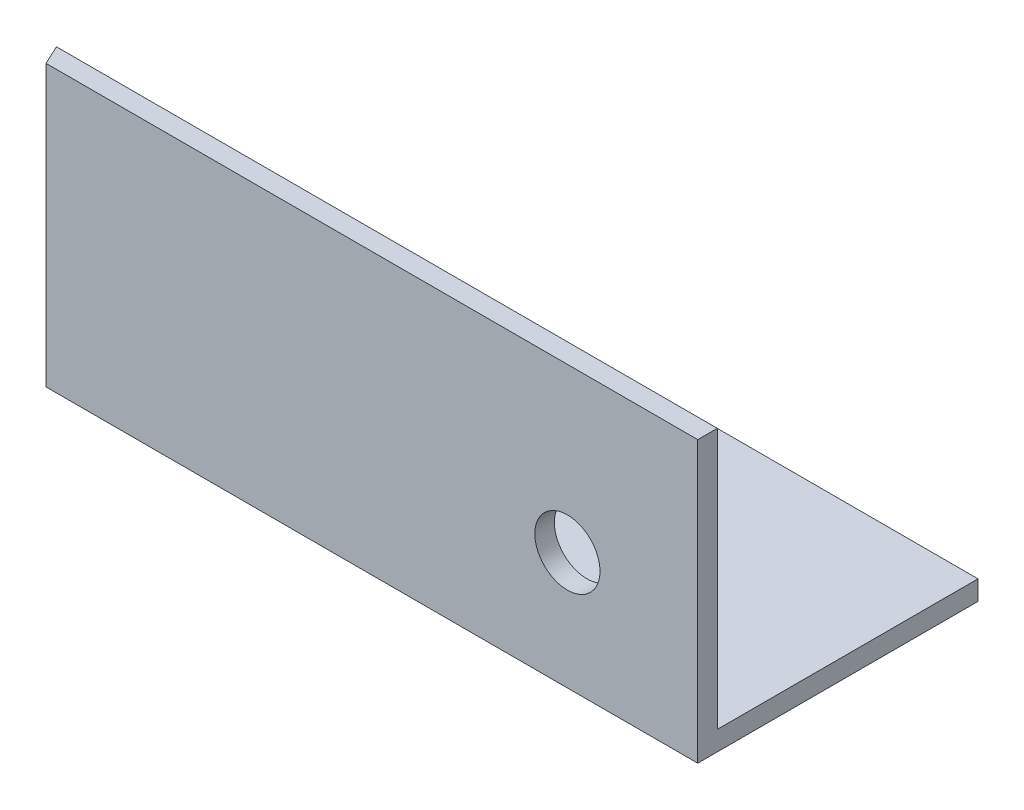
from build123d import *

# Parameters (mm, degrees)
EXTRUDE_1_DEPTH     = 120
CUT_EXTRUDE_1_DEPTH = 50
SKETCH_3_R          = 5
CUT_EXTRUDE_2_DEPTH = 10


with BuildPart() as part:
    # Эскиз1 → Вытянуть-Тонкостенный1 (new body)
    with BuildSketch(Plane(origin=(0, 0, 0), x_dir=(0, 0, -1), z_dir=(1, 0, 0))):
        Polygon((0, 40), (0, 0), (40, 0), (40, -3), (-3, -3), (-3, 40), align=None)
    extrude(amount=EXTRUDE_1_DEPTH)

    # Эскиз2 → Вырез-Вытянуть1 (cut)
    with BuildSketch(Plane(origin=(0, -3, 0), x_dir=(1, 0, 0), z_dir=(0, 1, 0))):
        Polygon((0, 40), (20, -3), (0, -3), align=None)
    extrude(amount=CUT_EXTRUDE_1_DEPTH, mode=Mode.SUBTRACT)

    # Эскиз3 → Вырез-Вытянуть2 (cut)
    with BuildSketch(Plane.XY.offset(3)):
        with Locations((100, 15)):
            Circle(SKETCH_3_R)
    extrude(amount=-CUT_EXTRUDE_2_DEPTH, mode=Mode.SUBTRACT)


solid = part.part
